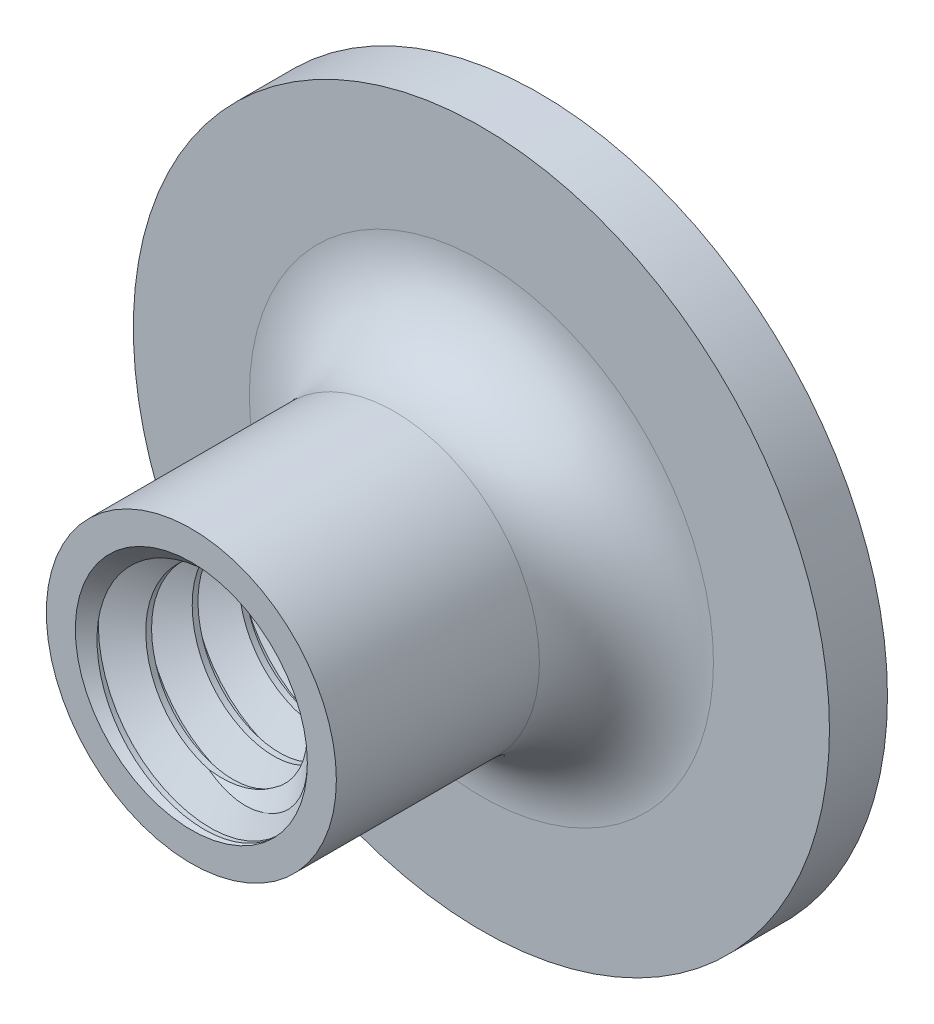
from build123d import *

# Parameters (mm, degrees)
SKETCH1_R          = 9.525
SKETCH1_R_2        = 3.175
EXTRUDE1_DEPTH     = 1.5875
SKETCH2_R          = 3.96875
SKETCH2_R_2        = 3.175
EXTRUDE2_DEPTH     = 7.9375
SWEEP1_PITCH       = 1.27
SKETCH5_R          = 9.525
CUT_EXTRUDE1_DEPTH = 18.66635547
SKETCH7_R          = 3.96875
CUT_EXTRUDE3_DEPTH = 17.497784
FILLET1_R          = 2.38125


with BuildPart() as part:
    # Sketch1 → Extrude1 (new body)
    with BuildSketch(Plane.XY):
        Circle(SKETCH1_R)
        Circle(SKETCH1_R_2, mode=Mode.SUBTRACT)
    extrude(amount=EXTRUDE1_DEPTH)

    # Sketch2 → Extrude2 (add)
    with BuildSketch(Plane.XY.offset(1.5875)):
        Circle(SKETCH2_R)
        Circle(SKETCH2_R_2, mode=Mode.SUBTRACT)
    extrude(amount=EXTRUDE2_DEPTH)

    # Sweep1: arcs per turn and ends read off the stored shape
    # Sweep1: the profile of Sketch4 profile screwed along a right-hand helix through 9 turns, 6 arcs to a turn; built about Z, then put on its axis
    sweep1_z = Axis((0, 0, 0), (0, 0, 1))
    sweep1_corners = [(3.1753, 0, -1.111423205), (3.1753, 0, 0.000173205), (2.350110803, 0, -0.47625), (2.350110803, 0, -0.635)]
    with BuildLine(mode=Mode.PRIVATE) as sweep1_profile:
        Line(sweep1_corners[0], sweep1_corners[1])
        Line(sweep1_corners[1], sweep1_corners[2])
        Line(sweep1_corners[2], sweep1_corners[3])
        Line(sweep1_corners[3], sweep1_corners[0])
    sweep1_cap = Face(sweep1_profile.wire())
    sweep1_turn_angles = [0, 30, 60, 90, 120, 150, 180, 210, 240, 270, 300, 330, 360]
    sweep1_turn_weights = [1, 0.8660254037844387, 1, 0.8660254037844387, 1, 0.8660254037844387, 1, 0.8660254037844387, 1, 0.8660254037844387, 1, 0.8660254037844387, 1]
    sweep1_turn_rails = [Edge.make_bspline([Vector(p[0], p[1], 0).rotate(sweep1_z, sweep1_turn_angles[k]) / sweep1_turn_weights[k] + Vector(0, 0, p[2] + SWEEP1_PITCH * sweep1_turn_angles[k] / 360) for k in range(13)], [0, 0, 0, 1, 1, 2, 2, 3, 3, 4, 4, 5, 5, 6, 6, 6], 2, sweep1_turn_weights) for p in sweep1_corners]
    sweep1_turn_sides = [Face.make_surface_from_curves(sweep1_turn_rails[p[0]], sweep1_turn_rails[p[1]]) for p in [(0, 1), (1, 2), (2, 3), (3, 0)]]
    sweep1_turn = Solid(Shell([*sweep1_turn_sides, sweep1_cap, sweep1_cap.rotate(sweep1_z, 360).moved(Location((0, 0, SWEEP1_PITCH * 360 / 360)))]))
    sweep1_each = [*[sweep1_turn.moved(Location((0, 0, SWEEP1_PITCH * i))) for i in range(9)]]
    add(Plane(origin=(0, 0, 0), x_dir=(-1, 0, 0), z_dir=(0, 0, 1)) * Compound([sweep1_each[i] for i in range(0, 9, 2)]))
    add(Plane(origin=(0, 0, 0), x_dir=(-1, 0, 0), z_dir=(0, 0, 1)) * Compound([sweep1_each[i] for i in range(1, 9, 2)]))

    # Sketch5 → Cut-Extrude1 (cut, through all)
    with BuildSketch(Plane(origin=(0, 0, 0), x_dir=(-1, 0, 0), z_dir=(0, 0, -1))):
        with Locations(Location((0, 0, 0), (0, 0, 180))):
            Circle(SKETCH5_R)
    extrude(amount=CUT_EXTRUDE1_DEPTH, mode=Mode.SUBTRACT)

    # Cut-Extrude2 cone 1 section (through the dimple's axis) → Cut-Extrude2 (revolve, cut)
    with BuildSketch(Plane.YZ):
        Polygon((0, 0), (3.175, 0), (0, 3.175), align=None)
    revolve(axis=Axis((0, 0, 0), (0, 0, 1)), mode=Mode.SUBTRACT)

    # Sketch7 → Cut-Extrude3 (cut, through all)
    with BuildSketch(Plane.XY.offset(9.525)):
        Circle(SKETCH7_R)
    extrude(amount=CUT_EXTRUDE3_DEPTH, mode=Mode.SUBTRACT)

    # Cut-Extrude4 cone 1 section (through the dimple's axis) → Cut-Extrude4 (revolve, cut)
    with BuildSketch(Plane(origin=(0, 0, 9.525), x_dir=(0, -1, 0), z_dir=(1, 0, 0))):
        Polygon((0, 0), (3.175, 0), (0, 3.175), align=None)
    revolve(axis=Axis((0, 0, 9.525), (0, 0, -1)), mode=Mode.SUBTRACT)

    # Fillet1
    fillet1_edges = [part.edges().sort_by_distance(p)[0] for p in [
        (-3.96875, 0, 1.5875),
    ]]
    fillet(fillet1_edges, radius=FILLET1_R)


solid = part.part
